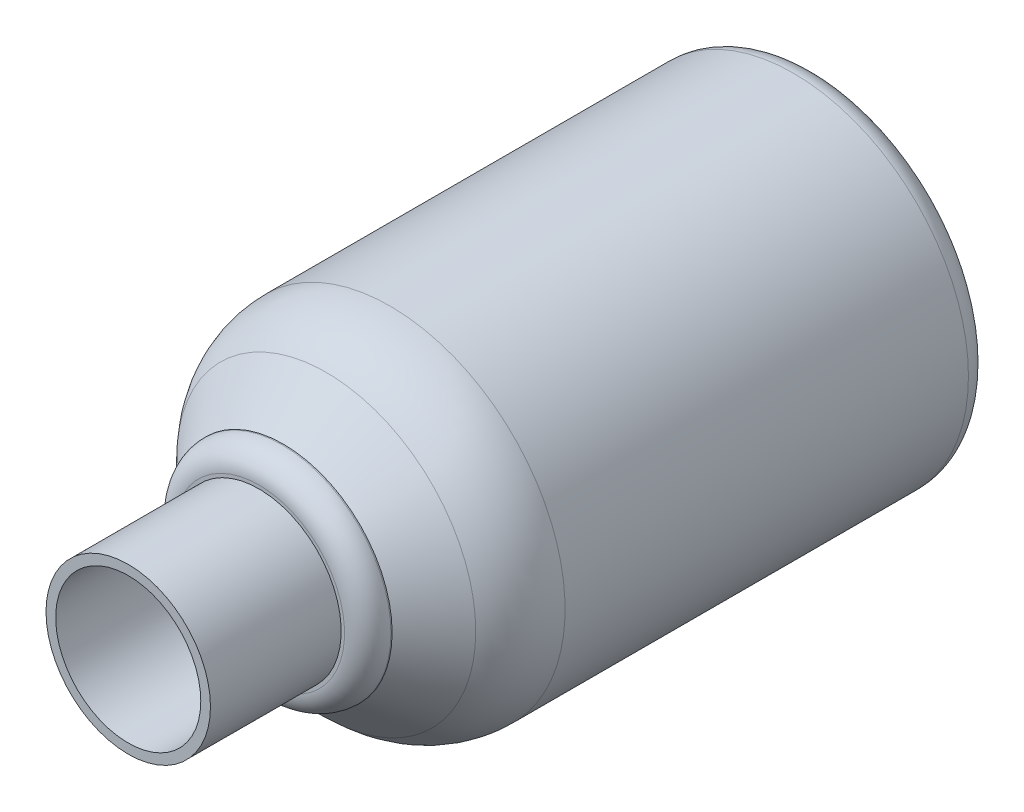
from build123d import *

# Parameters (mm, degrees)
SKETCH2_R           = 8.87
SKETCH2_R_2         = 7.825
BOSS_EXTRUDE1_DEPTH = 14.63
SKETCH3_R           = 11.735
SKETCH3_R_2         = 10.685
BOSS_EXTRUDE2_DEPTH = 2.63
FILLET1_R           = 2.5
FILLET2_R           = 1
SKETCH6_R           = 7.825
CUT_EXTRUDE2_DEPTH  = 18.63
SKETCH7_R           = 18.88
BOSS_EXTRUDE3_DEPTH = 1
SKETCH10_R          = 18.88
SKETCH10_R_2        = 17.83
BOSS_EXTRUDE4_DEPTH = 49
FILLET3_R           = 2.5
FILLET6_R           = 10


# Read off the part's stored shape, not the designer's step: Loft5, Loft6
with BuildPart() as part:
    # Sketch2 → Boss-Extrude1 (new body)
    with BuildSketch(Plane.XY):
        Circle(SKETCH2_R)
        Circle(SKETCH2_R_2, mode=Mode.SUBTRACT)
    extrude(amount=BOSS_EXTRUDE1_DEPTH)


with BuildPart() as body_2:
    # Sketch3 → Boss-Extrude2 (new body)
    with BuildSketch(Plane(origin=(0, 0, -2.1), x_dir=(-1, 0, 0), z_dir=(0, 0, -1))):
        Circle(SKETCH3_R)
        Circle(SKETCH3_R_2, mode=Mode.SUBTRACT)
    extrude(amount=-BOSS_EXTRUDE2_DEPTH)


    add(part.part)  # loft1 joins it to this body
    # loft up to a face of the part (loft1)
    loft([Face(Wire([body_2.edges().sort_by_distance((8.033160288, -8.554446843, 0.53))[0]])), Face(Wire([body_2.edges().sort_by_distance((-6.07193283, -6.465951725, 0))[0]]))])

    # Fillet1
    fillet1_edges = [body_2.edges().sort_by_distance(p)[0] for p in [
        (11.735, 0, 0.53),
    ]]
    fillet(fillet1_edges, radius=FILLET1_R)

    # Fillet2
    fillet2_edges = [body_2.edges().sort_by_distance(p)[0] for p in [
        (10.685, 0, 0.335759162),
    ]]
    fillet(fillet2_edges, radius=FILLET2_R)

    # Sketch6 → Cut-Extrude2 (cut)
    with BuildSketch(Plane.XY.offset(14.63)):
        Circle(SKETCH6_R)
    extrude(amount=-CUT_EXTRUDE2_DEPTH, mode=Mode.SUBTRACT)



with BuildPart() as body_2_2:
    # Sketch7 → Boss-Extrude3 (new body)
    with BuildSketch(Plane.XY.offset(-59.62)):
        Circle(SKETCH7_R)
    extrude(amount=BOSS_EXTRUDE3_DEPTH)

    # Sketch10 → Boss-Extrude4 (add)
    with BuildSketch(Plane.XY.offset(-58.62)):
        Circle(SKETCH10_R)
        Circle(SKETCH10_R_2, mode=Mode.SUBTRACT)
    extrude(amount=BOSS_EXTRUDE4_DEPTH)

    # Fillet3
    fillet3_edges = [body_2_2.edges().sort_by_distance(p)[0] for p in [
        (-18.88, 0, -59.62),
    ]]
    fillet(fillet3_edges, radius=FILLET3_R)


with BuildPart() as body_3:
    # Loft5 outline → Loft5 (revolve)
    with BuildSketch(Plane.XZ):
        Polygon((10.685, -2.1), (0, -2.1), (0, -9.62), (17.83, -9.62), align=None)
    revolve(axis=Axis((0, 0, 0), (0, 0, 1)))


with BuildPart() as body_2_1:
    add(body_2.part)

    add(body_2_2.part)  # Loft6 merges body 2 2

    add(body_3.part)  # Loft6 merges body 3
    # Loft6 outline → Loft6 (revolve)
    with BuildSketch(Plane.XZ):
        Polygon((18.88, -9.62), (11.735, -2.1), (10.685, -2.1), (17.83, -9.62), align=None)
    revolve(axis=Axis((0, 0, 0), (0, 0, 1)))

    # Fillet6
    fillet6_edges = [body_2_1.edges().sort_by_distance(p)[0] for p in [
        (-18.88, 0, -9.62),
    ]]
    fillet(fillet6_edges, radius=FILLET6_R)


solid = body_2_1.part
